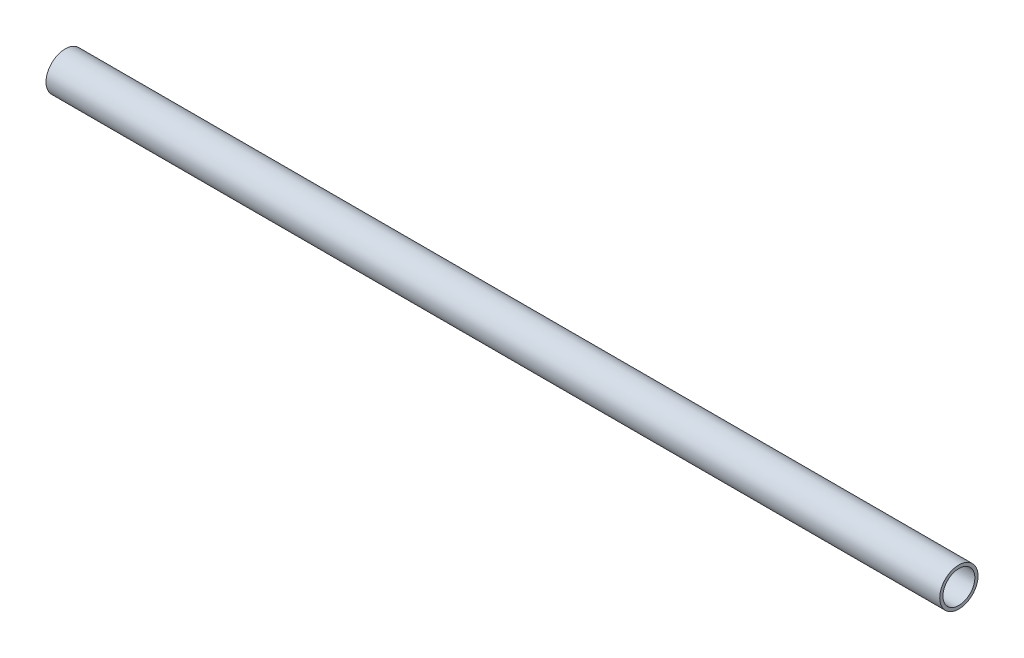
from build123d import *

# Parameters (mm, degrees)
SKETCH1_W = 140
SKETCH1_H = 0.5


with BuildPart() as part:
    # Sketch1 → Revolve1 (revolve)
    with BuildSketch(Plane(origin=(0, 0, 0), x_dir=(1, 0, 0), z_dir=(0, 1, 0))):
        with Locations((70, 2.75)):
            Rectangle(SKETCH1_W, SKETCH1_H)
    revolve(axis=Axis((-0.956467941, 0, 0), (1, 0, 0)))


solid = part.part
